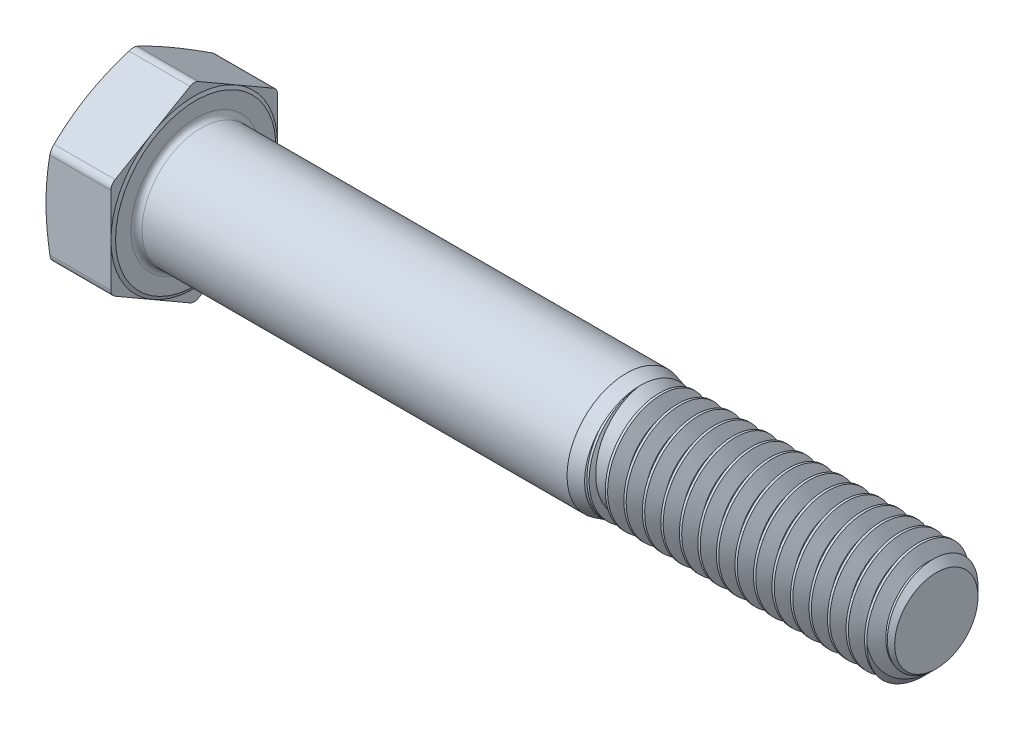
from build123d import *

# Parameters (mm, degrees)
SKETCH2_R                = 4.7625
BOSS_EXTRUDE1_DEPTH      = 63.5
BOSS_EXTRUDE2_DEPTH      = 5.953125
SKETCH5_OUTSIDE_W        = 63.56
SKETCH5_OUTSIDE_H        = 65.77
SKETCH5_OUTSIDE_R        = 6.429375
CUT_EXTRUDE1_DEPTH       = 5.953125
CUT_EXTRUDE1_DRAFT       = -70
BOSS_EXTRUDE5_DEPTH      = 0.0635
FILLET5_R                = 0.0635
FILLET6_R                = 0.0635
CIRPATTERN1_COUNT        = 6
FILLET5_OF_CIRPATTERN1_R = 0.0635
FILLET6_OF_CIRPATTERN1_R = 0.0635
FILLET7_R                = 0.714375
CHAMFER1_SIZE            = 1.190625
FILLET4_R                = 0.47625
CUT_SWEEP1_PITCH         = 1.5875
CUT_SWEEP1_TO            = 25.4


with BuildPart() as part:
    # Sketch2 → Boss-Extrude1 (new body)
    with BuildSketch(Plane(origin=(0, 0, 0), x_dir=(0, 0, -1), z_dir=(1, 0, 0))):
        Circle(SKETCH2_R)
    extrude(amount=BOSS_EXTRUDE1_DEPTH)

    # Sketch3 → Boss-Extrude2 (add)
    with BuildSketch(Plane.ZY):
        Polygon((0, 8.248891971), (-7.14375, 4.124445986), (-7.14375, -4.124445986), (0, -8.248891971), (7.14375, -4.124445986), (7.14375, 4.124445986), align=None)
    extrude(amount=BOSS_EXTRUDE2_DEPTH)


with BuildPart() as cut_extrude1_tool:
    # Sketch5 outside → Cut-Extrude1 (with draft: the straight prism first)
    with BuildSketch(Plane.ZY.offset(5.953125)):
        Rectangle(SKETCH5_OUTSIDE_W, SKETCH5_OUTSIDE_H)
        Circle(SKETCH5_OUTSIDE_R, mode=Mode.SUBTRACT)
    extrude(amount=-CUT_EXTRUDE1_DEPTH)
    # Cut-Extrude1: the draft: its side faces are tilted about the plane it starts from
    cut_extrude1_sides = [cut_extrude1_tool.faces().sort_by_distance(p)[0] for p in [
        (-2.9765625, -32.885, 0),
        (-2.9765625, 0, 31.78),
        (-2.9765625, 32.885, 0),
        (-2.9765625, 0, -31.78),
        (-2.9765625, 0, -6.429375),
    ]]
    draft(cut_extrude1_sides, Plane.ZY.offset(5.953125), CUT_EXTRUDE1_DRAFT)


with BuildPart() as part_1:
    add(part.part)

    # Cut-Extrude1: cut by cut_extrude1_tool
    add(cut_extrude1_tool.part, mode=Mode.SUBTRACT)

    # Sketch11 → Boss-Extrude5 (add)
    with BuildSketch(Plane.ZY.offset(5.953125)):
        with BuildLine():
            Line((0.28575, 5.0720625), (0.28575, 2.7860625))
            ThreePointArc((0.28575, 2.7860625), (0, 2.5003125), (-0.28575, 2.7860625))
            Line((-0.28575, 2.7860625), (-0.28575, 5.0720625))
            ThreePointArc((-0.28575, 5.0720625), (0, 5.3578125), (0.28575, 5.0720625))
        make_face()
    boss_extrude5 = extrude(amount=BOSS_EXTRUDE5_DEPTH)

    # Fillet5
    fillet5_edges = [part_1.edges().sort_by_distance(p)[0] for p in [
        (-6.016625, 3.9290625, 0.28575),
        (-6.016625, 2.5003125, 0),
        (-6.016625, 3.9290625, -0.28575),
        (-6.016625, 5.3578125, 0),
    ]]
    fillet(fillet5_edges, radius=FILLET5_R - 0.0001)  # a hair under: the kernel refuses the full size

    # Fillet6
    fillet6_edges = [part_1.edges().sort_by_distance(p)[0] for p in [
        (-5.953125, 5.3578125, 0),
        (-5.953125, 3.9290625, -0.28575),
        (-5.953125, 2.5003125, 0),
        (-5.953125, 3.9290625, 0.28575),
    ]]
    fillet(fillet6_edges, radius=FILLET6_R)

    # CirPattern1: Boss-Extrude5 ×6 about axis
    cirpattern1_axis = Axis((0, 0, 0), (1, 0, 0))
    for i in range(1, CIRPATTERN1_COUNT):
        add(boss_extrude5.rotate(cirpattern1_axis, i * 360 / CIRPATTERN1_COUNT))

    # Fillet5 of CirPattern1
    fillet5_of_cirpattern1_edges = [part_1.edges().sort_by_distance(p)[0] for p in [
        (-6.016625, 1.717064491, 3.545542938),
        (-6.016625, 1.25015625, 2.165334142),
        (-6.016625, 2.211998009, 3.259792938),
        (-6.016625, 2.67890625, 4.640001734),
        (-6.016625, -2.211998009, 3.259792938),
        (-6.016625, -1.25015625, 2.165334142),
        (-6.016625, -1.717064491, 3.545542938),
        (-6.016625, -2.67890625, 4.640001734),
        (-6.016625, -3.9290625, -0.28575),
        (-6.016625, -2.5003125, 0),
        (-6.016625, -3.9290625, 0.28575),
        (-6.016625, -5.3578125, 0),
        (-6.016625, -1.717064491, -3.545542938),
        (-6.016625, -1.25015625, -2.165334142),
        (-6.016625, -2.211998009, -3.259792938),
        (-6.016625, -2.67890625, -4.640001734),
        (-6.016625, 2.211998009, -3.259792938),
        (-6.016625, 1.25015625, -2.165334142),
        (-6.016625, 1.717064491, -3.545542938),
        (-6.016625, 2.67890625, -4.640001734),
    ]]
    fillet(fillet5_of_cirpattern1_edges, radius=FILLET5_OF_CIRPATTERN1_R - 0.0001)  # a hair under: the kernel refuses the full size

    # Fillet6 of CirPattern1
    fillet6_of_cirpattern1_edges = [part_1.edges().sort_by_distance(p)[0] for p in [
        (-5.953125, 2.67890625, 4.640001734),
        (-5.953125, 2.211998009, 3.259792938),
        (-5.953125, 1.25015625, 2.165334142),
        (-5.953125, 1.717064491, 3.545542938),
        (-5.953125, -2.67890625, 4.640001734),
        (-5.953125, -1.717064491, 3.545542938),
        (-5.953125, -1.25015625, 2.165334142),
        (-5.953125, -2.211998009, 3.259792938),
        (-5.953125, -5.3578125, 0),
        (-5.953125, -3.9290625, 0.28575),
        (-5.953125, -2.5003125, 0),
        (-5.953125, -3.9290625, -0.28575),
        (-5.953125, -2.67890625, -4.640001734),
        (-5.953125, -2.211998009, -3.259792938),
        (-5.953125, -1.25015625, -2.165334142),
        (-5.953125, -1.717064491, -3.545542938),
        (-5.953125, 2.67890625, -4.640001734),
        (-5.953125, 1.717064491, -3.545542938),
        (-5.953125, 1.25015625, -2.165334142),
        (-5.953125, 2.211998009, -3.259792938),
    ]]
    fillet(fillet6_of_cirpattern1_edges, radius=FILLET6_OF_CIRPATTERN1_R)

    # Fillet7
    fillet7_edges = [part_1.edges().sort_by_distance(p)[0] for p in [
        (-2.645437491, -8.248891971, 0),
        (-2.645437491, -4.124445986, -7.14375),
        (-2.645437491, 4.124445986, -7.14375),
        (-2.645437491, 8.248891971, 0),
        (-2.645437491, -4.124445986, 7.14375),
        (-2.645437491, 4.124445986, 7.14375),
    ]]
    fillet(fillet7_edges, radius=FILLET7_R)

    # Chamfer1
    chamfer1_edges = [part_1.edges().sort_by_distance(p)[0] for p in [
        (63.5, 0, 4.7625),
    ]]
    chamfer(chamfer1_edges, length=CHAMFER1_SIZE)

    # Sketch15 → Cut-Revolve1 (revolve, cut)
    with BuildSketch(Plane.XY, mode=Mode.PRIVATE) as cut_revolve1_sk:
        Polygon((0, 6.871397621), (-0.127, 7.14375), (-0.127, 8.248891971), (0, 8.248891971), align=None)
    revolve(cut_revolve1_sk.sketch.rotate(Axis((0, 0, 0), (1, 0, 0)), 90), axis=Axis((0, 0, 0), (1, 0, 0)), mode=Mode.SUBTRACT)

    # Sketch16 → Revolve1 (revolve)
    with BuildSketch(Plane.XY, mode=Mode.PRIVATE) as revolve1_sk:
        Polygon((38.1, 4.7625), (36.915073869, 5.08), (0, 5.08), (0, 0), (38.1, 0), align=None)
    revolve(revolve1_sk.sketch.rotate(Axis((0, 0, 0), (1, 0, 0)), 90), axis=Axis((0, 0, 0), (1, 0, 0)))

    # Fillet4
    fillet4_edges = [part_1.edges().sort_by_distance(p)[0] for p in [
        (0, 0, -5.08),
    ]]
    fillet(fillet4_edges, radius=FILLET4_R)


with BuildPart() as body_2:
    # Split1: the piece on the far side of the plane
    add(part_1.part)
    split(bisect_by=Plane(origin=(38.1, 0, 0), x_dir=(0, 0, 1), z_dir=(1, 0, 0)), keep=Keep.BOTTOM)


with BuildPart() as part_2:
    add(part_1.part)

    # Split1
    split(bisect_by=Plane(origin=(38.1, 0, 0), x_dir=(0, 0, 1), z_dir=(1, 0, 0)), keep=Keep.TOP)

    # Cut-Sweep1: arcs per turn and ends read off the stored shape
    # Cut-Sweep1: the profile of Sketch13 profile screwed along a right-hand helix through 17 turns, 8 arcs to a turn; built about Z, then put on its axis
    cut_sweep1_z = Axis((0, 0, 0), (0, 0, 1))
    cut_sweep1_corners = [(4.7628, 0, 0.000173205), (4.7628, 0, -1.389235705), (3.731388504, 0, -0.79375), (3.731388504, 0, -0.5953125)]
    with BuildLine(mode=Mode.PRIVATE) as cut_sweep1_profile:
        Line(cut_sweep1_corners[0], cut_sweep1_corners[1])
        Line(cut_sweep1_corners[1], cut_sweep1_corners[2])
        Line(cut_sweep1_corners[2], cut_sweep1_corners[3])
        Line(cut_sweep1_corners[3], cut_sweep1_corners[0])
    cut_sweep1_cap = Face(cut_sweep1_profile.wire())
    cut_sweep1_turn_angles = [0, 22.5, 45, 67.5, 90, 112.5, 135, 157.5, 180, 202.5, 225, 247.5, 270, 292.5, 315, 337.5, 360]
    cut_sweep1_turn_weights = [1, 0.9238795325112867, 1, 0.9238795325112867, 1, 0.9238795325112867, 1, 0.9238795325112867, 1, 0.9238795325112867, 1, 0.9238795325112867, 1, 0.9238795325112867, 1, 0.9238795325112867, 1]
    cut_sweep1_turn_rails = [Edge.make_bspline([Vector(p[0], p[1], 0).rotate(cut_sweep1_z, cut_sweep1_turn_angles[k]) / cut_sweep1_turn_weights[k] + Vector(0, 0, p[2] + CUT_SWEEP1_PITCH * cut_sweep1_turn_angles[k] / 360) for k in range(17)], [0, 0, 0, 1, 1, 2, 2, 3, 3, 4, 4, 5, 5, 6, 6, 7, 7, 8, 8, 8], 2, cut_sweep1_turn_weights) for p in cut_sweep1_corners]
    cut_sweep1_turn_sides = [Face.make_surface_from_curves(cut_sweep1_turn_rails[p[0]], cut_sweep1_turn_rails[p[1]]) for p in [(0, 1), (1, 2), (2, 3), (3, 0)]]
    cut_sweep1 = Plane(origin=(63.5, 0, 0), x_dir=(0, 1, 0), z_dir=(-1, 0, 0)) * split(Solid(Shell([*[p.moved(Location((0, 0, CUT_SWEEP1_PITCH * i))) for i in range(17) for p in cut_sweep1_turn_sides], cut_sweep1_cap, cut_sweep1_cap.rotate(cut_sweep1_z, 6120).moved(Location((0, 0, CUT_SWEEP1_PITCH * 6120 / 360)))])), bisect_by=Plane.XY.offset(CUT_SWEEP1_TO), keep=Keep.BOTTOM, mode=Mode.PRIVATE)
    add(cut_sweep1, mode=Mode.SUBTRACT)


with BuildPart() as boss_extrude4_tool:
    # Boss-Extrude4: read off the stored shape, not the designer's step
    # Boss-Extrude4 outline → Boss-Extrude4 (revolve)
    with BuildSketch(Plane.YX):
        Polygon((4.7625, 38.1), (3.731384309, 39.763019363), (3.731384309, 38.1), align=None)
    revolve(axis=Axis((0, 0, 0), (1, 0, 0)))


with BuildPart() as part_3:
    add(part_2.part)


with BuildPart() as part_4:
    # Boss-Extrude4: joined with boss_extrude4_tool
    add(part_3.part.fuse(boss_extrude4_tool.part, body_2.part, tol=0.00001))


solid = part_4.part
